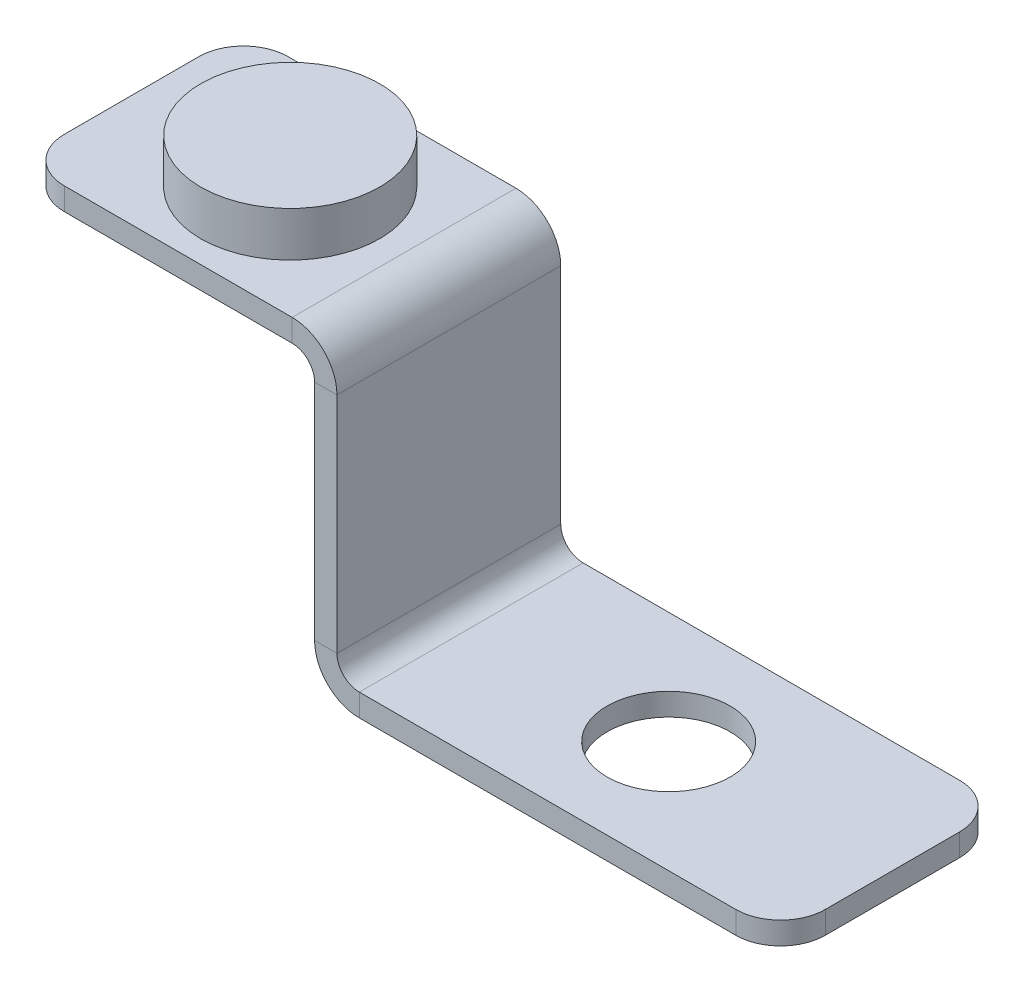
from build123d import *
from build123d.topology import SkipClean

# Parameters (mm, degrees)
SKETCH1_R           = 2.75
BASE_FLANGE1_DEPTH  = 1
JOG1_START          = -5.188227046
JOG1_DEPTH          = 10
JOG1_START_2        = -3.188227046
JOG1_2_DEPTH        = 6
JOG1_START_3        = 11
JOG1_3_DEPTH        = 1.974011807
JOG1_4_OUTLINE_W    = 1
JOG1_4_OUTLINE_H    = 2
JOG1_4_DEPTH        = 11.152182036
JOG1_START_4        = 12
JOG1_5_DEPTH        = 1
JOG1_6_DEPTH        = 10
JOG1_7_DEPTH        = 10
SKETCH7_R           = 4
BOSS_EXTRUDE2_DEPTH = 2


with BuildPart() as part:
    # Base-Flange1: sheet metal written as solids
    # Sketch1 → Base-Flange1 (new body)
    with BuildSketch(Plane(origin=(0, 0, 0), x_dir=(1, 0, 0), z_dir=(0, 1, 0))):
        with BuildLine():
            Line((-9.72493422, 5.188227046), (20.27506578, 5.188227046))
            ThreePointArc((20.27506578, 5.188227046), (21.689279343, 4.602440608), (22.27506578, 3.188227046))
            Line((22.27506578, 3.188227046), (22.27506578, -2.811772954))
            ThreePointArc((22.27506578, -2.811772954), (21.689279343, -4.225986516), (20.27506578, -4.811772954))
            Line((20.27506578, -4.811772954), (-9.72493422, -4.811772954))
            ThreePointArc((-9.72493422, -4.811772954), (-11.139147782, -4.225986516), (-11.72493422, -2.811772954))
            Line((-11.72493422, -2.811772954), (-11.72493422, 3.188227046))
            ThreePointArc((-11.72493422, 3.188227046), (-11.139147782, 4.602440608), (-9.72493422, 5.188227046))
        make_face()
        with Locations(Location((12.27506578, 0.188227046, 0), (0, 0, 270))):
            Circle(SKETCH1_R, mode=Mode.SUBTRACT)
    extrude(amount=-BASE_FLANGE1_DEPTH)

    # Jog1: read off the stored shape, not the designer's step
    # Jog1 outline → Jog1 (cut)
    with BuildSketch(Plane.XY.offset(JOG1_START)):
        with BuildLine():
            ThreePointArc((3.453163025, -1), (2.453163025, -0.732050807), (1.721112218, 0))
            Line((1.721112218, 0), (-11.72493422, 0))
            Line((-11.72493422, 0), (-11.72493422, -1))
            Line((-11.72493422, -1), (3.453163025, -1))
        make_face()
    extrude(amount=JOG1_DEPTH, mode=Mode.SUBTRACT)

    # Jog1 2 outline → Jog1 2 (add)
    with BuildSketch(Plane.XY.offset(JOG1_START_2)):
        with BuildLine():
            Line((1.453163025, 11), (1.453163025, 1))
            ThreePointArc((1.453163025, 1), (1.521311373, 0.48236191), (1.721112218, 0))
            Line((1.721112218, 0), (3.453163025, 0))
            ThreePointArc((3.453163025, 0), (2.746056244, 0.292893219), (2.453163025, 1))
            Line((2.453163025, 1), (2.453163025, 11))
            ThreePointArc((2.453163025, 11), (1.867376588, 12.414213563), (0.453163025, 13))
            Line((0.453163025, 13), (-11.72493422, 13))
            Line((-11.72493422, 13), (-11.72493422, 12))
            Line((-11.72493422, 12), (0.453163025, 12))
            ThreePointArc((0.453163025, 12), (1.160269807, 11.707106782), (1.453163025, 11))
        make_face()
    extrude(amount=JOG1_2_DEPTH)

    # Jog1 3 outline → Jog1 3 (add)
    with BuildSketch(Plane(origin=(0, 0, 0), x_dir=(1, 0, 0), z_dir=(0, 1, 0)).offset(JOG1_START_3)):
        with BuildLine():
            Line((2.453163025, -4.811772954), (2.453163025, -2.811772954))
            Line((2.453163025, -2.811772954), (-11.72493422, -2.811772954))
            ThreePointArc((-11.72493422, -2.811772954), (-11.139147782, -4.225986516), (-9.72493422, -4.811772954))
            Line((-9.72493422, -4.811772954), (2.453163025, -4.811772954))
        make_face()
        with BuildLine():
            Line((-11.72493422, 3.188227046), (2.453163025, 3.188227046))
            Line((2.453163025, 3.188227046), (2.453163025, 5.188227046))
            Line((2.453163025, 5.188227046), (-9.72493422, 5.188227046))
            ThreePointArc((-9.72493422, 5.188227046), (-11.139147782, 4.602440608), (-11.72493422, 3.188227046))
        make_face()
    extrude(amount=JOG1_3_DEPTH)

    # Jog1 4 outline → Jog1 4 (add)
    with BuildSketch(Plane(origin=(0, 0, 0), x_dir=(1, 0, 0), z_dir=(0, 1, 0))):
        with Locations((1.953163025, -3.811772954)):
            Rectangle(JOG1_4_OUTLINE_W, JOG1_4_OUTLINE_H)
        with Locations((1.953163025, 4.188227046)):
            Rectangle(JOG1_4_OUTLINE_W, JOG1_4_OUTLINE_H)
    extrude(amount=JOG1_4_DEPTH)

    # Jog1 5 outline → Jog1 5 (add)
    with BuildSketch(Plane(origin=(0, 0, 0), x_dir=(1, 0, 0), z_dir=(0, 1, 0)).offset(JOG1_START_4)):
        with BuildLine():
            Line((-9.72493422, -4.811772954), (1.453163025, -4.811772954))
            Line((1.453163025, -4.811772954), (1.453163025, -2.811772954))
            Line((1.453163025, -2.811772954), (-11.72493422, -2.811772954))
            ThreePointArc((-11.72493422, -2.811772954), (-11.139147782, -4.225986516), (-9.72493422, -4.811772954))
        make_face()
        with BuildLine():
            Line((-11.72493422, 3.188227046), (1.453163025, 3.188227046))
            Line((1.453163025, 3.188227046), (1.453163025, 5.188227046))
            Line((1.453163025, 5.188227046), (-9.72493422, 5.188227046))
            ThreePointArc((-9.72493422, 5.188227046), (-11.139147782, 4.602440608), (-11.72493422, 3.188227046))
        make_face()
    extrude(amount=JOG1_5_DEPTH)

    # Jog1 6 outline → Jog1 6 (cut)
    with SkipClean():  # the faces are left unmerged after this step: merging them gives an invalid solid
        with BuildSketch(Plane.XY.offset(JOG1_START)):
            with BuildLine():
                ThreePointArc((2.453163024, -0.732050806), (2.038949462, -0.414213561), (1.721112218, 0))
                ThreePointArc((1.721112218, 0), (1.521311373, 0.48236191), (1.453163025, 1))
                Line((1.453163025, 1), (1.453163025, 11))
                ThreePointArc((1.453163025, 11), (1.160269807, 11.707106782), (0.453163025, 12))
                Line((0.453163025, 12), (-13, 12))
                Line((-13, 12), (-13, -2))
                Line((-13, -2), (2.453163024, -2))
                Line((2.453163024, -2), (2.453163024, -0.732050806))
            make_face()
            with BuildLine():
                Line((2.453163025, 12.974011807), (1.453163025, 12.974011807))
                Line((1.453163025, 12.974011807), (1.453163025, 13))
                Line((1.453163025, 13), (1.453163017, 14))
                Line((1.453163017, 14), (-13, 14))
                Line((-13, 14), (-13, 12.999999997))
                Line((-13, 12.999999997), (0.453163025, 13))
                ThreePointArc((0.453163025, 13), (1.867376588, 12.414213563), (2.453163025, 11))
                Line((2.453163025, 11), (2.453163025, 12.974011807))
            make_face()
        extrude(amount=JOG1_6_DEPTH, mode=Mode.SUBTRACT)
    add(part.part.scale(1), mode=Mode.REPLACE)  # the faces are merged on a copy

    # Jog1 7 outline → Jog1 7 (add)
    with SkipClean():  # the faces are left unmerged after this step: merging them gives an invalid solid
        with BuildSketch(Plane.XY.offset(JOG1_START)):
            with BuildLine():
                Line((2.453163022, 0), (2.453163024, -0.732050806))
                ThreePointArc((2.453163024, -0.732050806), (2.935524934, -0.931851652), (3.453163025, -1))
                Line((3.453163025, -1), (5, -1.000000001))
                Line((5, -1.000000001), (5, -1e-09))
                Line((5, -1e-09), (3.453163025, 0))
                ThreePointArc((3.453163025, 0), (2.746056244, 0.292893219), (2.453163025, 1))
                Line((2.453163025, 1), (2.453163022, 0))
            make_face()
        extrude(amount=JOG1_7_DEPTH)
    add(part.part.scale(1), mode=Mode.REPLACE)  # the faces are merged on a copy


with BuildPart() as body_2:
    # Sketch7 → Boss-Extrude2 (new body)
    with BuildSketch(Plane(origin=(0, 13, 0), x_dir=(1, 0, 0), z_dir=(0, 1, 0))):
        with Locations(Location((-4.635885597, 0.188227046, 0), (0, 0, 270))):
            Circle(SKETCH7_R)
    extrude(amount=BOSS_EXTRUDE2_DEPTH)


solid = Compound([part.part, body_2.part])
